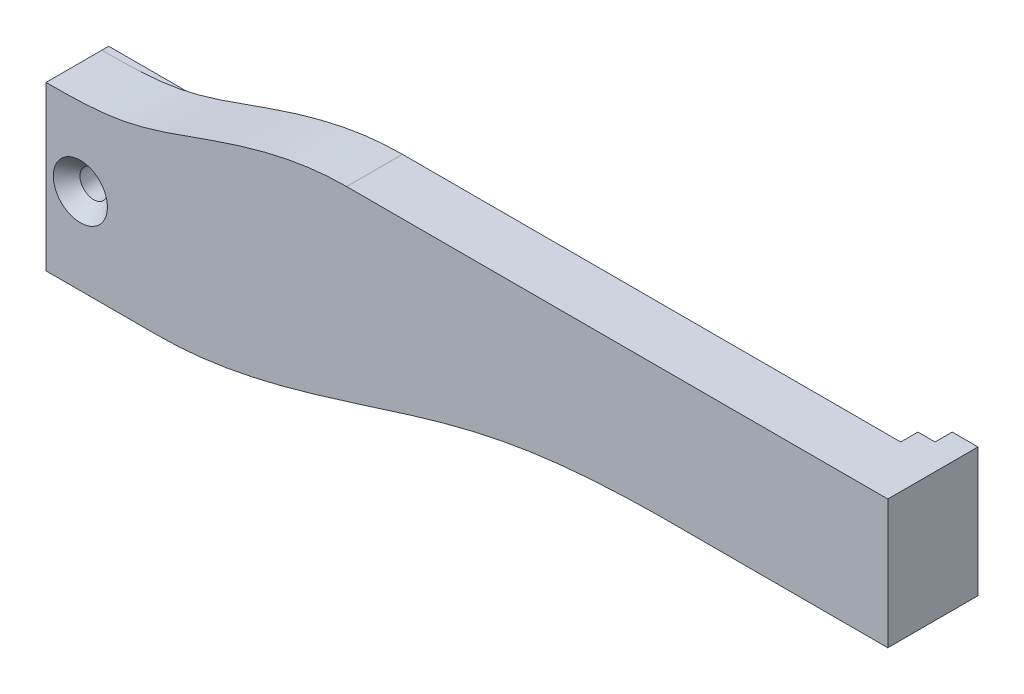
from build123d import *

# Parameters (mm, degrees)
SKETCH1_W                                       = 98
SKETCH1_H                                       = 26
BOSS_EXTRUDE1_DEPTH                             = 6.5
BOSS_EXTRUDE2_DEPTH                             = 2
CUT_EXTRUDE2_DEPTH                              = 91.435656014
CUT_EXTRUDE2_DEPTH_BACK                         = 91.435656014
BOSS_EXTRUDE3_DEPTH                             = 0.8
SKETCH6_W                                       = 3
SKETCH6_H                                       = 15
BOSS_EXTRUDE4_DEPTH                             = 2
CHAMFER1_SIZE                                   = 0.8
CSK_FOR_M3_FLAT_HEAD_MACHINE_SCREW1_D           = 3.2
CSK_FOR_M3_FLAT_HEAD_MACHINE_SCREW1_CSINK_D     = 6.3
CSK_FOR_M3_FLAT_HEAD_MACHINE_SCREW1_CSINK_ANGLE = 90
SKETCH12_R                                      = 2
CUT_EXTRUDE3_DEPTH                              = 5


with BuildPart() as part:
    # Sketch1 → Boss-Extrude1 (new body)
    with BuildSketch(Plane.XY):
        with Locations((-4.722668085, 59.458490272)):
            Rectangle(SKETCH1_W, SKETCH1_H)
    extrude(amount=BOSS_EXTRUDE1_DEPTH)

    # Sketch3 → Boss-Extrude2 (add)
    with BuildSketch(Plane(origin=(0, 0, 0), x_dir=(-1, 0, 0), z_dir=(0, 0, -1))):
        Polygon((-44.277331915, 72.458490272), (-44.277331915, 57.458490272), (-42.277331915, 57.458490272), (-42.277331915, 70.458490272), (-39.277331915, 70.458490272), (-39.277331915, 72.458490272), align=None)
    extrude(amount=BOSS_EXTRUDE2_DEPTH)

    # Sketch4 → Cut-Extrude2 (cut, two sides: drawn at the far end of the back side and taken through both)
    with BuildSketch(Plane(origin=(0, 0, 0), x_dir=(-1, 0, 0), z_dir=(0, 0, -1)).offset(-CUT_EXTRUDE2_DEPTH_BACK)):
        with BuildLine():
            Line((-44.277331915, 57.458490272), (-19.277331915, 57.458490272))
            add(Edge.make_bspline(
                [(-19.277331915, 57.458490272), (-7.832942992, 57.458490272), (8.904121741, 55.154017843), (29.529578832, 46.458490272), (40.722668085, 46.458490272)],
                knots=[0, 0, 0, 0, 0.448705595, 1, 1, 1, 1], degree=3))
            Line((40.722668085, 46.458490272), (-44.277331915, 46.458490272))
            Line((-44.277331915, 46.458490272), (-44.277331915, 57.458490272))
        make_face()
        with BuildLine():
            Line((18.722668085, 72.458490272), (53.722668085, 72.458490272))
            Line((53.722668085, 72.458490272), (53.722668085, 65.458490272))
            add(Edge.make_bspline(
                [(18.722668085, 72.458490272), (24.237785364, 72.458490272), (33.045165364, 69.996464802), (44.178399876, 65.548896557), (50.961091511, 65.458490272), (53.722668085, 65.458490272)],
                knots=[0, 0, 0, 0, 0.451492406, 0.761184281, 1, 1, 1, 1], degree=3))
        make_face()
    extrude(amount=CUT_EXTRUDE2_DEPTH + CUT_EXTRUDE2_DEPTH_BACK, mode=Mode.SUBTRACT)

    # Sketch5 → Boss-Extrude3 (add)
    with BuildSketch(Plane(origin=(0, 0, 0), x_dir=(-1, 0, 0), z_dir=(0, 0, -1))):
        with BuildLine():
            Line((43.222668085, 46.458490272), (40.722668085, 46.458490272))
            Line((40.722668085, 46.458490272), (40.722668085, 64.958490272))
            Line((40.722668085, 64.958490272), (41.222668085, 65.458490272))
            Line((41.222668085, 65.458490272), (53.722668085, 65.458490272))
            Line((53.722668085, 65.458490272), (53.722668085, 62.958490272))
            Line((53.722668085, 62.958490272), (44.122668085, 62.958490272))
            ThreePointArc((44.122668085, 62.958490272), (43.486271982, 62.694886375), (43.222668085, 62.058490272))
            Line((43.222668085, 62.058490272), (43.222668085, 46.458490272))
        make_face()
    extrude(amount=BOSS_EXTRUDE3_DEPTH)

    # Sketch6 → Boss-Extrude4 (add)
    with BuildSketch(Plane(origin=(0, 0, -2), x_dir=(-1, 0, 0), z_dir=(0, 0, -1))):
        with Locations((-42.777331915, 64.958490272)):
            Rectangle(SKETCH6_W, SKETCH6_H)
    extrude(amount=BOSS_EXTRUDE4_DEPTH)

    # Chamfer1
    chamfer1_edges = [part.edges().sort_by_distance(p)[0] for p in [
        (42.277331915, 63.958490272, -2),
    ]]
    chamfer(chamfer1_edges, length=CHAMFER1_SIZE)

    # CSK for M3 Flat Head Machine Screw1 (through all)
    with Locations(Plane.XY.offset(6.5)):
        with Locations((-49.722668085, 56.458490272)):
            CounterSinkHole(CSK_FOR_M3_FLAT_HEAD_MACHINE_SCREW1_D / 2, CSK_FOR_M3_FLAT_HEAD_MACHINE_SCREW1_CSINK_D / 2, counter_sink_angle=CSK_FOR_M3_FLAT_HEAD_MACHINE_SCREW1_CSINK_ANGLE)

    # Sketch12 → Cut-Extrude3 (cut)
    with BuildSketch(Plane(origin=(0, 0, 0), x_dir=(-1, 0, 0), z_dir=(0, 0, -1))):
        with Locations((19.647668085, 68.883490272)):
            Circle(SKETCH12_R)
    extrude(amount=-CUT_EXTRUDE3_DEPTH, mode=Mode.SUBTRACT)


solid = part.part
